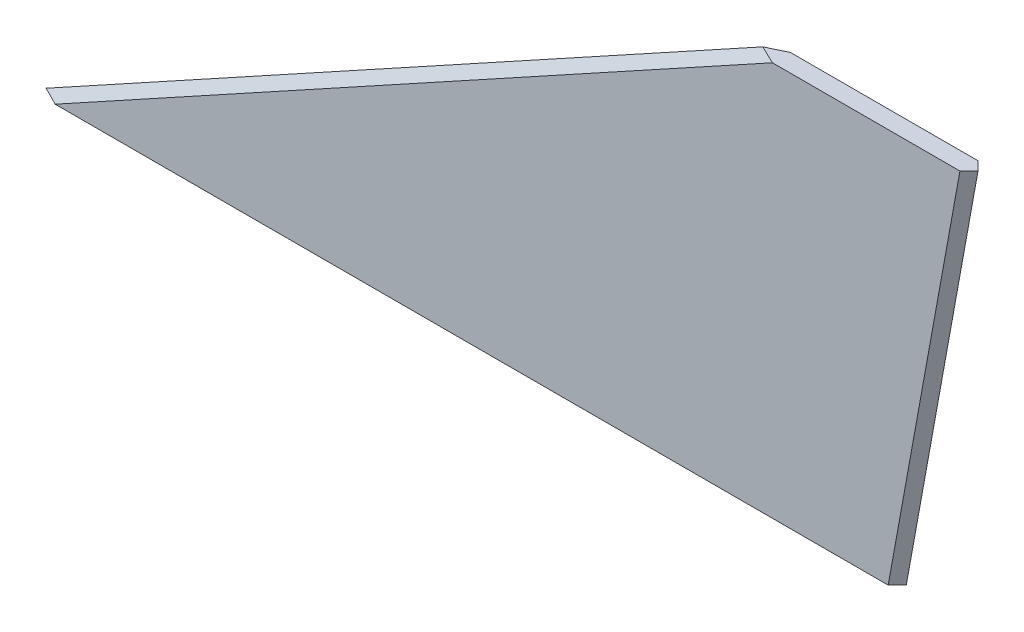
from build123d import *

# Parameters (mm, degrees)
BOSS_EXTRUDE1_DEPTH     = 6.35
CHAMFER1_SIZE           = 3.175
CUT_EXTRUDE1_DEPTH      = 316.484
CUT_EXTRUDE1_DEPTH_BACK = 13.716
SKETCH2_R               = 50.8


with BuildPart() as part:
    # Sketch1 → Boss-Extrude1 (new body)
    with BuildSketch(Plane.XY):
        Polygon((254, 139.7), (0, 0), (254, 0), align=None)
        Polygon((254, 139.7), (254, 0), (304.8, 0), (330.2, 139.7), align=None)
    extrude(amount=BOSS_EXTRUDE1_DEPTH)

    # Chamfer1
    chamfer1_edges = [part.edges().sort_by_distance(p)[0] for p in [
        (317.5, 69.85, 0),
        (317.5, 69.85, 6.35),
        (127, 69.85, 6.35),
        (127, 69.85, 0),
    ]]
    chamfer(chamfer1_edges, length=CHAMFER1_SIZE - 0.0001)  # a hair under: the kernel refuses the full size

    # Sketch2 → Cut-Extrude1 (cut, two sides: drawn at the far end of the back side and taken through both)
    with BuildSketch(Plane(origin=(0, 0, 0), x_dir=(0, 0, -1), z_dir=(1, 0, 0)).offset(-CUT_EXTRUDE1_DEPTH_BACK)):
        with Locations((-3.175, -50.700684167)):
            Circle(SKETCH2_R)
    extrude(amount=CUT_EXTRUDE1_DEPTH + CUT_EXTRUDE1_DEPTH_BACK, mode=Mode.SUBTRACT)


solid = part.part
